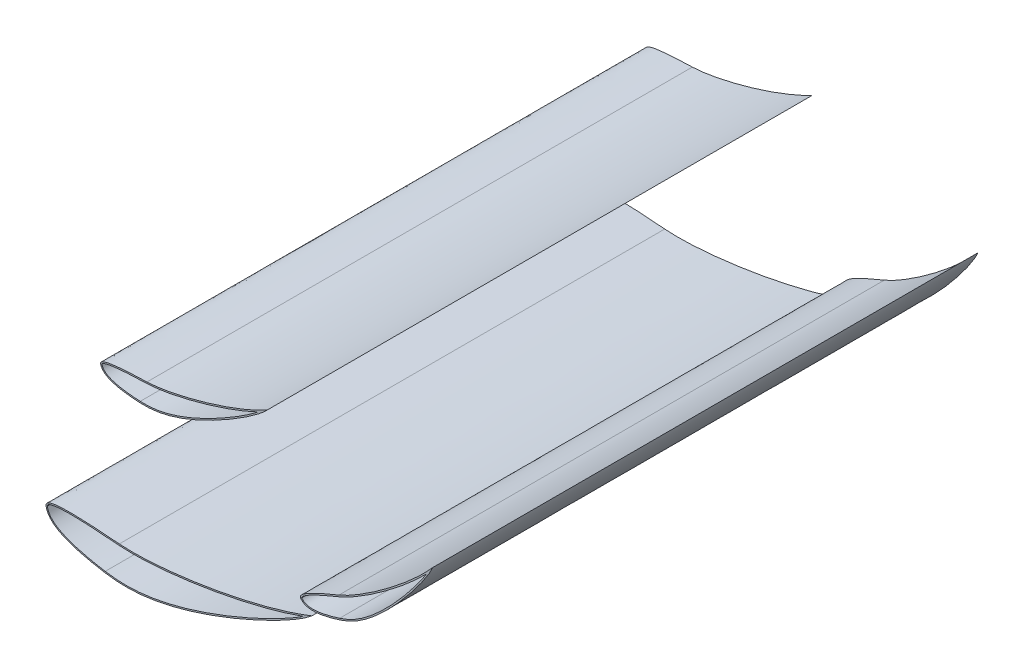
from build123d import *

# Parameters (mm, degrees)
BOSS_EXTRUDE1_START = -508
BOSS_EXTRUDE1_DEPTH = 1016
CUT_EXTRUDE1_DEPTH  = 1016


# Read off the part's stored shape, not the designer's step: Boss-Extrude1
with BuildPart() as part:
    # Boss-Extrude1 outline → Boss-Extrude1 (new body)
    with BuildSketch(Plane.XY.offset(BOSS_EXTRUDE1_START)):
        with BuildLine():
            add(Edge.make_bspline(
                [(1534.125218089, 1055.326252108), (1581.431949858, 1056.805878726), (1689.315252125, 1085.016786668), (1757.607244921, 1121.521601297)],
                knots=[0, 0, 0, 0, 1, 1, 1, 1], degree=3))
            add(Edge.make_bspline(
                [(1447.8, 1041.4), (1445.462070328, 1050.440103277), (1478.940552136, 1053.600225017), (1534.125218089, 1055.326252108)],
                knots=[0, 0, 0, 0, 1, 1, 1, 1], degree=3))
            add(Edge.make_bspline(
                [(1447.8, 1041.4), (1451.716243249, 1026.257010945), (1473.057931861, 1017.761641947), (1521.547121316, 1015.342863335)],
                knots=[0, 0, 0, 0, 1, 1, 1, 1], degree=3))
            add(Edge.make_bspline(
                [(1521.547121316, 1015.342863335), (1568.644659373, 1012.993504251), (1622.668296723, 1028.481644325), (1731.676333789, 1093.334869305), (1757.607244921, 1121.521601297)],
                knots=[0, 0, 0, 0, 0, 1, 1, 1, 1, 1], degree=4))
        make_face()
        with BuildLine():
            add(Edge.make_bspline(
                [(1891.766554433, 890.397858243), (1932.822233042, 907.22888176), (2018.295627471, 967.421914577), (2066.279647657, 1021.899481385)],
                knots=[0, 0, 0, 0, 1, 1, 1, 1], degree=3))
            add(Edge.make_bspline(
                [(1820.534034371, 849.82655048), (1815.512986309, 856.997350261), (1843.873922142, 870.763984253), (1891.766554433, 890.397858243)],
                knots=[0, 0, 0, 0, 1, 1, 1, 1], degree=3))
            add(Edge.make_bspline(
                [(1820.534034371, 849.82655048), (1828.944743133, 837.814813526), (1850.474718561, 837.361664466), (1893.848671091, 851.157604529)],
                knots=[0, 0, 0, 0, 1, 1, 1, 1], degree=3))
            add(Edge.make_bspline(
                [(1893.848671091, 851.157604529), (1935.977780753, 864.557597795), (1978.332509839, 895.895210264), (2052.763183562, 988.634239719), (2066.279647657, 1021.899481385)],
                knots=[0, 0, 0, 0, 0, 1, 1, 1, 1, 1], degree=4))
        make_face()
        with BuildLine():
            add(Edge.make_bspline(
                [(1482.67938066, 768.350687552), (1556.382717782, 762.280127075), (1728.856746333, 786.99392024), (1841.334034371, 831.58655048)],
                knots=[0, 0, 0, 0, 1, 1, 1, 1], degree=3))
            add(Edge.make_bspline(
                [(1346.2, 762), (1344.169480658, 776.447895845), (1396.702313833, 775.432171297), (1482.67938066, 768.350687552)],
                knots=[0, 0, 0, 0, 1, 1, 1, 1], degree=3))
            add(Edge.make_bspline(
                [(1346.2, 762), (1349.601303196, 737.798470222), (1381.230675202, 720.8348651), (1456.080175882, 708.503048798)],
                knots=[0, 0, 0, 0, 1, 1, 1, 1], degree=3))
            add(Edge.make_bspline(
                [(1456.080175882, 708.503048798), (1528.781477893, 696.525158589), (1615.390341712, 711.014112819), (1796.091765402, 792.414548707), (1841.334034371, 831.58655048)],
                knots=[0, 0, 0, 0, 0, 1, 1, 1, 1, 1], degree=4))
        make_face()
    extrude(amount=BOSS_EXTRUDE1_DEPTH)

    # Sketch2 → Cut-Extrude1 (cut)
    with BuildSketch(Plane.XY.offset(508)):
        with BuildLine():
            add(Edge.make_bspline(
                [(1521.673666393, 1017.879709082), (1526.780839315, 1017.624948778), (1531.84955319, 1017.621907429), (1541.908969055, 1018.126421614), (1546.900122335, 1018.63102341), (1556.815783884, 1020.076426377), (1561.740496921, 1021.01588732), (1571.53582143, 1023.248910263), (1576.406481309, 1024.542155434), (1583.679670778, 1026.696705307), (1586.100182069, 1027.451318109), (1590.924202125, 1029.023115268), (1593.323050354, 1029.838717425), (1600.48442636, 1032.364892642), (1605.211974494, 1034.154407839), (1614.591238881, 1037.904575778), (1619.242890621, 1039.865374117), (1628.482486724, 1043.930745733), (1633.070390489, 1046.035410635), (1646.751160728, 1052.53658689), (1655.762142146, 1057.117896609), (1669.141521481, 1064.299252489), (1673.574500234, 1066.743310169), (1682.378024723, 1071.72240255), (1686.750283451, 1074.258319112), (1695.435025393, 1079.42410079), (1699.747559453, 1082.053885993), (1708.308157638, 1087.414783126), (1712.556357446, 1090.145681806), (1720.977098644, 1095.726390714), (1725.15005127, 1098.575554609), (1731.334115222, 1102.967750821), (1733.38278305, 1104.451755971), (1737.448452821, 1107.469535217), (1739.465574143, 1109.003121685), (1741.461462848, 1110.570079237)],
                knots=[0, 0, 0, 0, 0.0625, 0.0625, 0.125, 0.125, 0.1875, 0.1875, 0.25, 0.25, 0.28125, 0.28125, 0.3125, 0.3125, 0.375, 0.375, 0.4375, 0.4375, 0.5, 0.5, 0.625, 0.625, 0.6875, 0.6875, 0.75, 0.75, 0.8125, 0.8125, 0.875, 0.875, 0.9375, 0.9375, 0.96875, 0.96875, 1, 1, 1, 1], degree=3))
            add(Edge.make_bspline(
                [(1741.461462848, 1110.570079237), (1733.304995198, 1106.708227421), (1725.052349931, 1103.094757743), (1708.401628313, 1096.243399373), (1700.003053846, 1093.006797079), (1683.083858365, 1086.848782075), (1674.563062945, 1083.92781977), (1661.698574485, 1079.761489484), (1657.397325948, 1078.409093207), (1648.7770535, 1075.778077549), (1644.456902544, 1074.499086072), (1631.466347724, 1070.771871273), (1622.7661756, 1068.432190871), (1609.650902969, 1065.159730046), (1605.26823757, 1064.108682682), (1596.478958905, 1062.093908182), (1592.075840303, 1061.130925313), (1583.255448018, 1059.307317735), (1578.837449515, 1058.446355063), (1569.982628915, 1056.847086494), (1565.545868538, 1056.108378428), (1556.647890668, 1054.79032778), (1552.186859704, 1054.209769749), (1545.468473281, 1053.5138252), (1543.224485017, 1053.311336442), (1538.724629309, 1052.983765079), (1536.468818796, 1052.858311501), (1534.204623588, 1052.787493599)],
                knots=[0, 0, 0, 0, 0.125, 0.125, 0.25, 0.25, 0.375, 0.375, 0.4375, 0.4375, 0.5, 0.5, 0.625, 0.625, 0.6875, 0.6875, 0.75, 0.75, 0.8125, 0.8125, 0.875, 0.875, 0.9375, 0.9375, 0.96875, 0.96875, 1, 1, 1, 1], degree=3))
            add(Edge.make_bspline(
                [(1534.204623588, 1052.787493599), (1527.054787366, 1052.563866061), (1519.906531254, 1052.306419233), (1509.188649116, 1051.823891474), (1505.616784125, 1051.646731392), (1498.475219772, 1051.246060001), (1494.905284527, 1051.022743762), (1487.769581373, 1050.50752904), (1484.205001469, 1050.216293767), (1477.086500041, 1049.524270987), (1473.53133468, 1049.125550631), (1468.216819972, 1048.374930574), (1466.449388026, 1048.099025179), (1462.927190132, 1047.467297083), (1461.173096512, 1047.112977608), (1458.565292028, 1046.476363852), (1457.700596739, 1046.246507923), (1455.986392093, 1045.733973348), (1455.136463893, 1045.451982794), (1453.886434227, 1044.962944785), (1453.473949911, 1044.788745154), (1452.664047655, 1044.408656236), (1452.265837974, 1044.202885942), (1451.690858166, 1043.856568885), (1451.502770978, 1043.734633945), (1451.139455164, 1043.47357884), (1450.963368355, 1043.334153374), (1450.636271168, 1043.03006159), (1450.481295142, 1042.865325013), (1450.302927436, 1042.580058191), (1450.251417675, 1042.4774301), (1450.214165135, 1042.25672329), (1450.230982044, 1042.144669972), (1450.259095007, 1042.03596521)],
                knots=[0, 0, 0, 0, 0.25, 0.25, 0.375, 0.375, 0.5, 0.5, 0.625, 0.625, 0.75, 0.75, 0.8125, 0.8125, 0.875, 0.875, 0.90625, 0.90625, 0.9375, 0.9375, 0.953125, 0.953125, 0.96875, 0.96875, 0.9765625, 0.9765625, 0.984375, 0.984375, 0.9921875, 0.9921875, 0.99609375, 0.99609375, 1, 1, 1, 1], degree=3))
            add(Edge.make_bspline(
                [(1450.259095007, 1042.03596521), (1450.679630444, 1040.409875326), (1451.328360264, 1038.887279688), (1452.421730083, 1037.112139652), (1452.65539543, 1036.762226216), (1453.144198265, 1036.083228354), (1453.399429537, 1035.753721043), (1454.195018143, 1034.79278003), (1454.765191259, 1034.18885436), (1455.973252825, 1033.043477162), (1456.614297477, 1032.499835037), (1457.933127995, 1031.481977547), (1458.61188591, 1031.006234497), (1460.695034827, 1029.659427867), (1462.145730016, 1028.867807183), (1465.133510539, 1027.432783155), (1466.675584729, 1026.788734106), (1469.774772284, 1025.628794576), (1471.338078967, 1025.109894907), (1476.0582619, 1023.687970936), (1479.244861862, 1022.91732048), (1485.666918102, 1021.593600011), (1488.902840934, 1021.042607784), (1495.408786569, 1020.092486739), (1498.681713169, 1019.693799395), (1505.237798837, 1019.010132733), (1508.520342568, 1018.725356775), (1515.092242884, 1018.242170682), (1518.381612527, 1018.043926087), (1521.673666393, 1017.879709082)],
                knots=[0, 0, 0, 0, 0.0625, 0.0625, 0.078125, 0.078125, 0.09375, 0.09375, 0.125, 0.125, 0.15625, 0.15625, 0.1875, 0.1875, 0.25, 0.25, 0.3125, 0.3125, 0.375, 0.375, 0.5, 0.5, 0.625, 0.625, 0.75, 0.75, 0.875, 0.875, 1, 1, 1, 1], degree=3))
        make_face()
        with BuildLine():
            add(Edge.make_bspline(
                [(1456.493086601, 711.009262025), (1460.574020208, 710.336908527), (1464.650882413, 709.768883698), (1472.796147504, 708.849601954), (1476.864557831, 708.49815441), (1489.057430708, 707.760485053), (1497.169488286, 707.692137572), (1513.365260765, 708.281716677), (1521.449064987, 708.937354411), (1537.593831286, 710.833954165), (1545.654812708, 712.074420488), (1555.719558051, 713.919212249), (1557.731930354, 714.302950103), (1561.755579949, 715.098485133), (1563.766924396, 715.510316901), (1569.785349302, 716.782719391), (1573.781719152, 717.681073342), (1585.728368081, 720.509775008), (1593.636422081, 722.573021197), (1609.361101193, 726.987275264), (1617.177644821, 729.338539597), (1632.733845699, 734.283059107), (1640.473452912, 736.87647177), (1655.885714039, 742.274024736), (1663.558339814, 745.078253602), (1678.843101125, 750.877097257), (1686.455225519, 753.871747114), (1701.622551771, 760.04020382), (1709.168196721, 763.210152607), (1724.173032048, 769.712487737), (1731.634238274, 773.045599211), (1746.471293333, 779.881544908), (1753.847255284, 783.384154207), (1768.50402938, 790.578566574), (1775.785162137, 794.26973214), (1790.229761306, 801.886028427), (1797.394360668, 805.808906412), (1808.012858705, 811.948533104), (1811.530693835, 814.038151981), (1818.507517364, 818.334399268), (1821.967055654, 820.539934289), (1825.381665003, 822.83480502)],
                knots=[0, 0, 0, 0, 0.03125, 0.03125, 0.0625, 0.0625, 0.125, 0.125, 0.1875, 0.1875, 0.25, 0.25, 0.265625, 0.265625, 0.28125, 0.28125, 0.3125, 0.3125, 0.375, 0.375, 0.4375, 0.4375, 0.5, 0.5, 0.5625, 0.5625, 0.625, 0.625, 0.6875, 0.6875, 0.75, 0.75, 0.8125, 0.8125, 0.875, 0.875, 0.9375, 0.9375, 0.96875, 0.96875, 1, 1, 1, 1], degree=3))
            add(Edge.make_bspline(
                [(1825.381665003, 822.83480502), (1818.52110212, 820.354749621), (1811.627540733, 817.994556647), (1797.78503217, 813.475351787), (1790.836038346, 811.316509343), (1769.916959738, 805.101864721), (1755.875444782, 801.305522598), (1727.637537904, 794.275407148), (1713.44084535, 791.042725822), (1684.909114884, 785.079883232), (1670.600192478, 782.355394034), (1641.902411083, 777.403060402), (1627.513097571, 775.174579328), (1605.863860149, 772.231774027), (1598.636076157, 771.317898529), (1584.158273181, 769.6370635), (1576.916169555, 768.870895649), (1562.424690022, 767.507186166), (1555.175326128, 766.909366006), (1540.667867347, 765.916175805), (1533.409802143, 765.520117517), (1518.882313845, 764.991362332), (1511.612982621, 764.856535193), (1500.69644104, 764.945176153), (1497.055477897, 765.023786767), (1489.767952339, 765.310841307), (1486.121420182, 765.518583595), (1482.470880108, 765.819259591)],
                knots=[0, 0, 0, 0, 0.0625, 0.0625, 0.125, 0.125, 0.25, 0.25, 0.375, 0.375, 0.5, 0.5, 0.625, 0.625, 0.6875, 0.6875, 0.75, 0.75, 0.8125, 0.8125, 0.875, 0.875, 0.9375, 0.9375, 0.96875, 0.96875, 1, 1, 1, 1], degree=3))
            add(Edge.make_bspline(
                [(1482.470880108, 765.819259591), (1471.119369094, 766.754224503), (1459.764215787, 767.634515377), (1442.720974035, 768.797160403), (1437.03811271, 769.157978245), (1425.667291356, 769.803077884), (1419.978830011, 770.087757846), (1408.596580519, 770.54249086), (1402.904619211, 770.713533846), (1394.364597486, 770.830073196), (1391.517572199, 770.845262189), (1385.822566025, 770.811302136), (1382.97366207, 770.762400275), (1377.279560744, 770.57227556), (1374.434693117, 770.431881615), (1370.172637774, 770.112353455), (1368.753551483, 769.987492333), (1365.92091147, 769.68879659), (1364.506693967, 769.515088958), (1361.687775373, 769.098514046), (1360.284298301, 768.85643251), (1357.496255452, 768.265437988), (1356.112609623, 767.91886176), (1354.080325412, 767.255796065), (1353.412205032, 767.011207443), (1352.10505235, 766.448380271), (1351.462882182, 766.129851383), (1350.56179067, 765.562524133), (1350.271290343, 765.358147536), (1349.721722045, 764.900740879), (1349.464662739, 764.650056464), (1349.0282833, 764.082008375), (1348.853072282, 763.764671141), (1348.7155092, 763.243698072), (1348.691218115, 763.067763714), (1348.678569107, 762.712101148), (1348.690240469, 762.531671565), (1348.715280895, 762.353499676)],
                knots=[0, 0, 0, 0, 0.25, 0.25, 0.375, 0.375, 0.5, 0.5, 0.625, 0.625, 0.6875, 0.6875, 0.75, 0.75, 0.8125, 0.8125, 0.84375, 0.84375, 0.875, 0.875, 0.90625, 0.90625, 0.9375, 0.9375, 0.953125, 0.953125, 0.96875, 0.96875, 0.9765625, 0.9765625, 0.984375, 0.984375, 0.9921875, 0.9921875, 0.99609375, 0.99609375, 1, 1, 1, 1], degree=3))
            add(Edge.make_bspline(
                [(1348.715280895, 762.353499676), (1349.08581891, 759.7169847), (1349.819873315, 757.197579341), (1351.188098672, 754.193505397), (1351.485206013, 753.598060982), (1352.118739392, 752.430610507), (1352.453984914, 751.860389173), (1353.511016308, 750.187210244), (1354.28397992, 749.121652158), (1355.531521261, 747.58769349), (1355.962081215, 747.087125737), (1356.850575435, 746.105994745), (1357.309504296, 745.624503043), (1358.712252378, 744.219941035), (1359.684472347, 743.333309626), (1362.691321801, 740.794488756), (1364.815071327, 739.261936911), (1368.125905699, 737.131195193), (1369.250710264, 736.449398264), (1371.536710121, 735.134656493), (1372.69599746, 734.502955703), (1376.191856611, 732.685562289), (1378.555945024, 731.571154759), (1383.333255502, 729.484816587), (1385.746614219, 728.51328221), (1390.611365978, 726.680504721), (1393.062823553, 725.819448739), (1400.462832212, 723.368615066), (1405.456425274, 721.909449305), (1413.008406178, 719.89930206), (1415.536182894, 719.259554972), (1420.609481478, 718.031517876), (1423.15609007, 717.443019008), (1430.80821284, 715.746306108), (1435.927189589, 714.705903222), (1446.191634911, 712.761978337), (1451.337155773, 711.8587265), (1456.493086601, 711.009262025)],
                knots=[0, 0, 0, 0, 0.0625, 0.0625, 0.078125, 0.078125, 0.09375, 0.09375, 0.125, 0.125, 0.140625, 0.140625, 0.15625, 0.15625, 0.1875, 0.1875, 0.25, 0.25, 0.28125, 0.28125, 0.3125, 0.3125, 0.375, 0.375, 0.4375, 0.4375, 0.5, 0.5, 0.625, 0.625, 0.6875, 0.6875, 0.75, 0.75, 0.875, 0.875, 1, 1, 1, 1], degree=3))
        make_face()
        with BuildLine():
            add(Edge.make_bspline(
                [(1893.07878024, 853.578114409), (1897.616036827, 855.02127825), (1902.038398659, 856.67021566), (1910.649909633, 860.385768441), (1914.840389856, 862.449999882), (1923.021781051, 866.935886187), (1927.013301876, 869.35644882), (1934.834101032, 874.488146245), (1938.66352596, 877.199018484), (1944.309198089, 881.441675611), (1946.175464833, 882.886057795), (1949.874638241, 885.82528943), (1951.703077761, 887.31653545), (1957.131873722, 891.848087129), (1960.676009435, 894.945897641), (1967.642367131, 901.266216999), (1971.064486403, 904.488830901), (1977.806318257, 911.038804445), (1981.125965899, 914.36623051), (1990.951661764, 924.484799232), (1997.326139896, 931.410517142), (2006.668224765, 942.02374291), (2009.742836278, 945.596764688), (2015.808422778, 952.801521465), (2018.800657367, 956.434645025), (2024.703275071, 963.76293901), (2027.613721878, 967.458061151), (2033.34684793, 974.914836939), (2036.169695873, 978.676362706), (2041.713317958, 986.276790477), (2044.434590841, 990.115314415), (2049.743593673, 997.893593453), (2052.333340482, 1001.831819689), (2054.816713431, 1005.850681788)],
                knots=[0, 0, 0, 0, 0.0625, 0.0625, 0.125, 0.125, 0.1875, 0.1875, 0.25, 0.25, 0.28125, 0.28125, 0.3125, 0.3125, 0.375, 0.375, 0.4375, 0.4375, 0.5, 0.5, 0.625, 0.625, 0.6875, 0.6875, 0.75, 0.75, 0.8125, 0.8125, 0.875, 0.875, 0.9375, 0.9375, 1, 1, 1, 1], degree=3))
            add(Edge.make_bspline(
                [(2054.816713431, 1005.850681788), (2048.942041578, 999.842050737), (2042.906917298, 994.014580229), (2030.592237282, 982.635617186), (2024.311893476, 977.08501443), (2011.545125111, 966.216486613), (2005.058423843, 960.898873974), (1995.187228739, 953.081814271), (1991.873521575, 950.503157492), (1985.207016782, 945.404107014), (1981.853314267, 942.88298679), (1971.730653767, 935.405122578), (1964.90082431, 930.532928472), (1954.522843872, 923.409701176), (1951.04116394, 921.066340343), (1944.028689816, 916.447837906), (1940.500368665, 914.17426758), (1933.398425607, 909.711800476), (1929.824157286, 907.522291946), (1922.619402325, 903.243963028), (1918.98909866, 901.154814927), (1911.655468105, 897.107304792), (1907.95269162, 895.147956972), (1902.318492065, 892.352279226), (1900.426929631, 891.444558099), (1896.608440305, 889.692454305), (1894.681678948, 888.84777516), (1892.730023325, 888.047682145)],
                knots=[0, 0, 0, 0, 0.125, 0.125, 0.25, 0.25, 0.375, 0.375, 0.4375, 0.4375, 0.5, 0.5, 0.625, 0.625, 0.6875, 0.6875, 0.75, 0.75, 0.8125, 0.8125, 0.875, 0.875, 0.9375, 0.9375, 0.96875, 0.96875, 1, 1, 1, 1], degree=3))
            add(Edge.make_bspline(
                [(1892.730023325, 888.047682145), (1886.547029971, 885.512926659), (1880.376443504, 882.949185357), (1871.155828731, 879.021185061), (1868.088261943, 877.697900671), (1861.970065784, 875.011761541), (1858.919184676, 873.649004189), (1852.843202478, 870.865333021), (1849.818948119, 869.445382787), (1843.815048469, 866.514182022), (1840.833754572, 865.004314364), (1836.426279304, 862.613998518), (1834.968875766, 861.796418451), (1832.090428673, 860.09689505), (1830.669375512, 859.216327335), (1828.590906558, 857.813630353), (1827.907405912, 857.332427306), (1826.569810292, 856.330342508), (1825.914989628, 855.809734962), (1824.97372897, 854.981494054), (1824.666774739, 854.697285132), (1824.074824345, 854.107346673), (1823.789057225, 853.801345373), (1823.256144707, 853.157333942), (1823.006034609, 852.81929976), (1822.702137431, 852.270880128), (1822.611675281, 852.081287175), (1822.522728279, 851.779977151), (1822.49903863, 851.675840904), (1822.503123278, 851.519630613), (1822.514977932, 851.467345913), (1822.55689098, 851.3716381), (1822.584497214, 851.326540918), (1822.614680563, 851.283434628)],
                knots=[0, 0, 0, 0, 0.25, 0.25, 0.375, 0.375, 0.5, 0.5, 0.625, 0.625, 0.75, 0.75, 0.8125, 0.8125, 0.875, 0.875, 0.90625, 0.90625, 0.9375, 0.9375, 0.953125, 0.953125, 0.96875, 0.96875, 0.984375, 0.984375, 0.9921875, 0.9921875, 0.99609375, 0.99609375, 0.998046875, 0.998046875, 1, 1, 1, 1], degree=3))
            add(Edge.make_bspline(
                [(1822.614680563, 851.283434628), (1823.515416965, 849.997049732), (1824.583352514, 848.877306428), (1826.12514577, 847.683811264), (1826.445001184, 847.454602599), (1827.096353401, 847.021819826), (1827.428263747, 846.817771793), (1828.441184355, 846.239661849), (1829.139337421, 845.899541494), (1830.574496254, 845.296226422), (1831.314831347, 845.032232252), (1832.803846001, 844.577137661), (1833.554409627, 844.384854189), (1835.820765999, 843.893396087), (1837.351044805, 843.678568982), (1840.438610979, 843.406176672), (1841.99991125, 843.349722089), (1845.093080695, 843.353147781), (1846.631754745, 843.41245149), (1851.230306764, 843.717547753), (1854.273024898, 844.088266442), (1860.330221801, 845.035290559), (1863.344432246, 845.613549437), (1869.353126427, 846.913680536), (1872.350043951, 847.636896168), (1878.315100552, 849.185758208), (1881.282948044, 850.011457215), (1887.196407078, 851.740507121), (1890.141976233, 852.64400604), (1893.07878024, 853.578114409)],
                knots=[0, 0, 0, 0, 0.0625, 0.0625, 0.078125, 0.078125, 0.09375, 0.09375, 0.125, 0.125, 0.15625, 0.15625, 0.1875, 0.1875, 0.25, 0.25, 0.3125, 0.3125, 0.375, 0.375, 0.5, 0.5, 0.625, 0.625, 0.75, 0.75, 0.875, 0.875, 1, 1, 1, 1], degree=3))
        make_face()
    extrude(amount=-CUT_EXTRUDE1_DEPTH, mode=Mode.SUBTRACT)


solid = part.part
